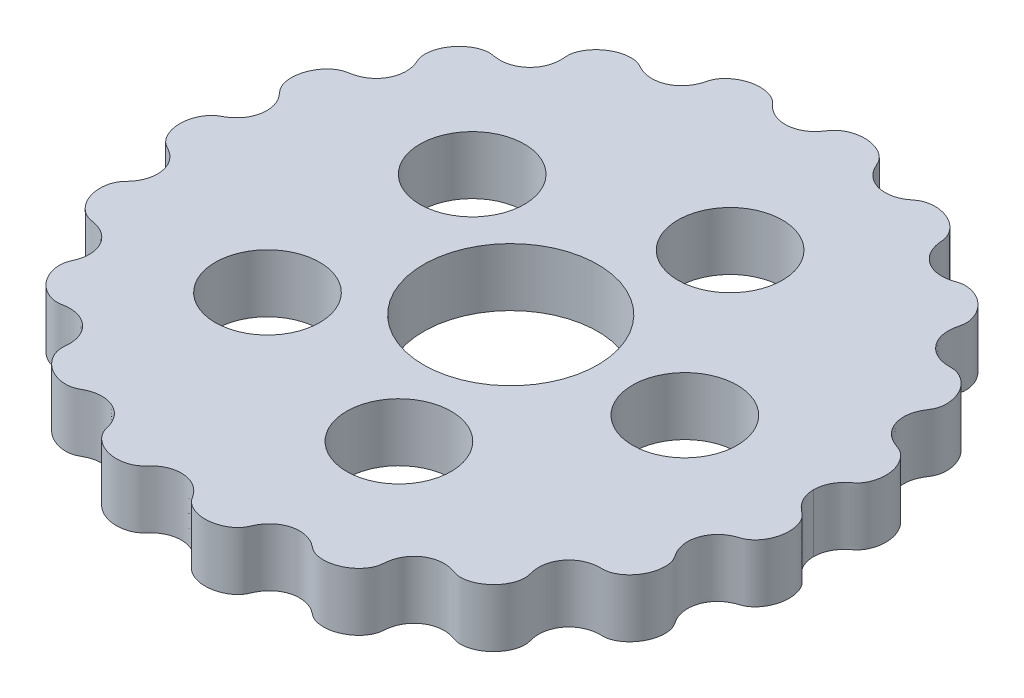
from build123d import *

# Parameters (mm, degrees)
BOSS_EXTRUDE1_START = 0.5
SKETCH1_R           = 7.5
SKETCH1_R_2         = 4.5
BOSS_EXTRUDE1_DEPTH = 5


with BuildPart() as part:
    # Sketch1 → Boss-Extrude1 (new body)
    with BuildSketch(Plane(origin=(0, 0, 0), x_dir=(1, 0, 0), z_dir=(0, 1, 0)).offset(BOSS_EXTRUDE1_START)):
        with BuildLine():
            add(Edge.make_bspline(
                [(26.100000001, 0), (26.100000001, -0.037654823), (26.101959838, -0.112657778), (26.110778914, -0.269126865), (26.134236474, -0.431457932), (26.169271903, -0.604227737), (26.215706935, -0.771665888), (26.2732951, -0.936077152), (26.341753555, -1.096140667), (26.42791585, -1.265624131), (26.534785055, -1.441856171), (26.699683699, -1.67031679), (26.901439537, -1.889875839), (27.124804262, -2.086960491), (27.362808408, -2.265185488), (27.541686596, -2.422902757), (27.696832367, -2.612532966), (27.831038284, -2.823925745), (27.942707415, -3.055157968), (28.03202713, -3.302051278), (28.113287071, -3.620150325), (28.164200717, -4.011385863), (28.158229713, -4.465911271), (28.068723695, -4.971978987), (27.92239684, -5.391891507), (27.752179239, -5.726439419), (27.579155333, -5.986088776), (27.422588117, -6.181127718), (27.208663225, -6.396612626), (26.970426875, -6.581500429), (26.704262294, -6.714420074), (26.426139512, -6.802056051), (26.208386955, -6.88526241), (25.996005014, -6.981754411), (25.792352169, -7.095680473), (25.506454674, -7.288419365), (25.166810016, -7.595932091), (24.823327667, -8.065640834), (24.573113299, -8.72284226), (24.513192387, -9.374110704), (24.595878356, -9.908866564), (24.732910005, -10.306165942), (24.863450158, -10.578322252), (24.983619743, -10.787813544), (25.118076956, -10.987994036), (25.243899655, -11.194436481), (25.335973849, -11.425133947), (25.399465389, -11.670686177), (25.434320143, -11.928228008), (25.441972483, -12.193681647), (25.418791023, -12.524941115), (25.342360013, -12.916594687), (25.191232071, -13.347764303), (24.944934542, -13.798710217), (24.636097612, -14.197365909), (24.319379047, -14.49299579), (24.014552178, -14.704170688), (23.744181638, -14.844097629), (23.521984724, -14.930759503), (23.295178334, -14.990896749), (23.066212193, -15.018050457), (22.836177534, -15.015427607), (22.60645362, -15.01876633), (22.377139997, -15.037432831), (22.149964766, -15.073477643), (21.901722716, -15.134262004), (21.63640528, -15.227464361), (21.285248205, -15.397408544), (20.867012032, -15.696199644), (20.457707614, -16.15442787), (20.167634199, -16.744097483), (20.040652676, -17.344074218), (20.044251146, -17.837567352), (20.101291606, -18.208300972), (20.178290253, -18.510160997), (20.237387066, -18.752911084), (20.254165851, -19.007094175), (20.236737197, -19.264546647), (20.175345509, -19.587685891), (20.045401482, -19.966212229), (19.825733649, -20.379092954), (19.503349148, -20.792215121), (19.125691798, -21.140607349), (18.706122195, -21.419205006), (18.312603135, -21.597813456), (17.95729147, -21.7007495), (17.659059083, -21.747208145), (17.425046357, -21.759337106), (17.196962801, -21.745982059), (16.978070969, -21.704489958), (16.767542661, -21.633081261), (16.557577445, -21.561231406), (16.343192492, -21.502693833), (16.125264663, -21.459296016), (15.796467785, -21.420434356), (15.354937396, -21.427964236), (14.788969176, -21.550301969), (14.15455542, -21.88057341), (13.666183717, -22.345893253), (13.336362649, -22.88226304), (13.173492136, -23.353715627), (13.104616128, -23.716957194), (13.076673276, -24.02279806), (13.057814189, -24.268242303), (12.998712206, -24.514111874), (12.903235056, -24.754151925), (12.744151814, -25.045309116), (12.499019902, -25.369043134), (12.155657151, -25.696338346), (11.704870213, -25.994619846), (11.211604108, -26.212225806), (10.68997676, -26.343697667), (10.221282682, -26.37756552), (9.820613034, -26.342575186), (9.498973158, -26.26665957), (9.255580912, -26.177092448), (9.029799659, -26.05655854), (8.831572762, -25.902571784), (8.58391576, -25.71111477), (8.264466121, -25.51104552), (7.810081456, -25.312340621), (7.205513819, -25.192791232), (6.550224924, -25.228730885), (5.971337018, -25.424349477), (5.536862389, -25.687803773), (5.245653307, -25.938729612), (5.055386261, -26.143844122), (4.899938262, -26.348212338), (4.774598738, -26.545523005), (4.664550041, -26.751857795), (4.569043476, -26.964881996), (4.476314366, -27.179586841), (4.353499791, -27.379281189), (4.203299856, -27.561863118), (4.032131292, -27.727950003), (3.79525899, -27.914521157), (3.482483914, -28.102825699), (3.089596665, -28.268830385), (2.604961188, -28.388334129), (2.095437226, -28.431200093), (1.573536083, -28.390048007), (1.119470453, -28.272805038), (0.751616161, -28.112409401), (0.4727867, -27.939857046), (0.273494127, -27.780889901), (0.100220004, -27.601224467), (-0.036900457, -27.400701128), (-0.167623208, -27.196704665), (-0.313051844, -27.002366981), (-0.512485215, -26.773835259), (-0.82522158, -26.489940267), (-1.286824513, -26.202366803), (-1.90652456, -26.003420899), (-2.599411552, -25.975353149), (-3.156761696, -26.100953574), (-3.565273795, -26.283242121), (-3.853430429, -26.463789354), (-4.04086224, -26.604608953), (-4.216144571, -26.760241463), (-4.380398314, -26.92724911), (-4.535647831, -27.102695562), (-4.7080389, -27.262129389), (-4.906562373, -27.395532872), (-5.122340191, -27.506639083), (-5.353111081, -27.594765526), (-5.595122061, -27.660809079), (-5.904112164, -27.714960075), (-6.280362612, -27.736643211), (-6.724192807, -27.701413515), (-7.222479813, -27.579956195), (-7.639241178, -27.403463388), (-7.974539318, -27.20159547), (-8.231562235, -27.001455404), (-8.420763278, -26.822438839), (-8.588375146, -26.628010192), (-8.72995142, -26.419225267), (-8.843841455, -26.197883212), (-8.918149441, -25.965106023), (-8.973095057, -25.727696563), (-9.043925472, -25.494305036), (-9.153099617, -25.209622768), (-9.306801805, -24.915867582), (-9.513499075, -24.623747571), (-9.839816184, -24.284860522), (-10.264400598, -23.977825959), (-10.829665694, -23.73805203), (-11.410498796, -23.660908882), (-11.87629172, -23.69638221), (-12.218754959, -23.773476834), (-12.444677349, -23.84513133), (-12.663781479, -23.935334112), (-12.876076728, -24.040286172), (-13.082031425, -24.157155246), (-13.298581127, -24.254322867), (-13.533913594, -24.317810826), (-13.780466914, -24.35378875), (-14.035834907, -24.361637388), (-14.296405869, -24.343065665), (-14.618522572, -24.288656576), (-14.994949775, -24.177456101), (-15.408578969, -23.98833338), (-15.837205257, -23.700628449), (-16.16490731, -23.393911292), (-16.404344734, -23.097848292), (-16.573318675, -22.829755719), (-16.687662049, -22.603571121), (-16.776686852, -22.372337621), (-16.837746076, -22.138542446), (-16.870186158, -21.9045043), (-16.866368415, -21.674536104), (-16.843233105, -21.446228653), (-16.832615307, -21.216921003), (-16.837266827, -20.987328792), (-16.860312682, -20.758768834), (-16.923293403, -20.419212422), (-17.071833991, -19.980587652), (-17.369040523, -19.477210915), (-17.874882375, -18.988476541), (-18.447970132, -18.67719025), (-19.027548133, -18.525710765), (-19.510111736, -18.503831617), (-19.876648139, -18.538267665), (-20.177623885, -18.593432706), (-20.42137194, -18.622411671), (-20.671244853, -18.609095567), (-20.920859774, -18.564988583), (-21.167935078, -18.490627654), (-21.4095885, -18.389962143), (-21.698210118, -18.235368531), (-22.02014446, -18.009296139), (-22.350982926, -17.698329853), (-22.663749807, -17.29065213), (-22.904833826, -16.843369276), (-23.047778376, -16.427343965), (-23.116267898, -16.057121475), (-23.132041389, -15.75076918), (-23.118687313, -15.513701439), (-23.079662445, -15.285779121), (-23.010740762, -15.071995011), (-22.917965638, -14.867945737), (-22.83178351, -14.661241535), (-22.759010837, -14.449176582), (-22.702274861, -14.232285466), (-22.657962991, -13.982307736), (-22.635886804, -13.699380389), (-22.650675117, -13.300053937), (-22.761871082, -12.783822482), (-23.029318636, -12.21492364), (-23.467562019, -11.712001704), (-23.923403017, -11.398122255), (-24.315464063, -11.222988994), (-24.609412241, -11.131419108), (-24.849484664, -11.076013531), (-25.092573068, -11.038656205), (-25.334505587, -10.990769991), (-25.569274268, -10.900544213), (-25.793687583, -10.779741828), (-26.00595477, -10.630692764), (-26.204437625, -10.457777096), (-26.430332209, -10.218351564), (-26.664824108, -9.899800806), (-26.878975385, -9.499593675), (-27.044436205, -9.01574461), (-27.129961923, -8.520121003), (-27.134474174, -8.0871314), (-27.084857153, -7.719810764), (-27.006013082, -7.425910719), (-26.920443462, -7.203342298), (-26.812236106, -6.99521479), (-26.678616217, -6.807274427), (-26.521312284, -6.639361313), (-26.367637465, -6.468593342), (-26.225484225, -6.287683037), (-26.097389186, -6.096643611), (-25.974680444, -5.876177314), (-25.864713462, -5.624531597), (-25.752433681, -5.264729725), (-25.681810261, -4.762581394), (-25.730997419, -4.146949182), (-25.961949285, -3.524047609), (-26.321265324, -3.010597952), (-26.690239717, -2.672986455), (-27.000992367, -2.462677557), (-27.274877294, -2.314024503), (-27.494163359, -2.194208061), (-27.693761752, -2.035785351), (-27.87238426, -1.849426066), (-28.029881681, -1.639477669), (-28.165833208, -1.41056993), (-28.278417605, -1.169112764), (-28.356850628, -0.949924532), (-28.409926509, -0.757383066), (-28.444786226, -0.594531067), (-28.467072671, -0.464613598), (-28.483773851, -0.334062838), (-28.494901548, -0.194206271), (-28.499073007, -0.086237954), (-28.499999999, -0.028769446), (-28.499999999, 0)],
                knots=[0.065357727, 0.065357727, 0.065357727, 0.065357727, 0.065357727, 0.066838802, 0.068319877, 0.069800952, 0.071282027, 0.072763102, 0.074244177, 0.075725252, 0.077206327, 0.079230954, 0.081255581, 0.085304836, 0.087329463, 0.08935409, 0.091378717, 0.093403344, 0.095635344, 0.097867345, 0.100099346, 0.102331347, 0.106795348, 0.11125935, 0.115505731, 0.119752112, 0.121875303, 0.123998494, 0.126121685, 0.128244875, 0.132212277, 0.134195978, 0.136179679, 0.13816338, 0.140147081, 0.142130782, 0.144114483, 0.149889299, 0.155664115, 0.161716618, 0.167769121, 0.171875721, 0.17392902, 0.17598232, 0.17803562, 0.18008892, 0.182142219, 0.184195519, 0.186452911, 0.188710303, 0.190967695, 0.193225087, 0.197739871, 0.202254655, 0.206449673, 0.210644692, 0.21483971, 0.216937219, 0.219034728, 0.220990732, 0.222946736, 0.22490274, 0.226858744, 0.228814748, 0.230770752, 0.232726756, 0.23468276, 0.237505487, 0.240328214, 0.245973668, 0.25207373, 0.258173791, 0.262418319, 0.266662848, 0.268785112, 0.270907376, 0.27302964, 0.275151904, 0.277414155, 0.279676405, 0.284200907, 0.288725408, 0.29324991, 0.297434601, 0.301619291, 0.305803982, 0.307896327, 0.309988673, 0.311878349, 0.313768025, 0.315657701, 0.317547377, 0.319437053, 0.32132673, 0.323216406, 0.325106082, 0.330697764, 0.336289446, 0.3427217, 0.349153953, 0.353337838, 0.357521724, 0.359613666, 0.361705609, 0.363797552, 0.365889495, 0.368183967, 0.37047844, 0.375067386, 0.379656332, 0.384245278, 0.388791482, 0.393337686, 0.39788389, 0.400156991, 0.402430093, 0.404562559, 0.406695025, 0.408827491, 0.410959957, 0.415224889, 0.419489821, 0.425619329, 0.431748836, 0.43728204, 0.440048642, 0.442815244, 0.444803142, 0.446791041, 0.44877894, 0.450766838, 0.452754737, 0.454742636, 0.456730534, 0.458718433, 0.460783687, 0.462848941, 0.466979449, 0.471109956, 0.475240464, 0.479777245, 0.484314026, 0.488850807, 0.491119197, 0.493387587, 0.495450918, 0.497514249, 0.499577579, 0.50164091, 0.503704241, 0.505767572, 0.509894233, 0.515977148, 0.522060063, 0.527644163, 0.533228263, 0.535221378, 0.537214493, 0.539207608, 0.541200724, 0.543193839, 0.545186954, 0.54718007, 0.549173185, 0.551305995, 0.553438805, 0.555571614, 0.557704424, 0.561970044, 0.566235664, 0.570664673, 0.575093682, 0.577308187, 0.579522691, 0.581737196, 0.583951701, 0.586025843, 0.588099985, 0.590174127, 0.592248269, 0.594322411, 0.596396553, 0.600544837, 0.603500405, 0.606455973, 0.612367108, 0.61826056, 0.624154012, 0.626168793, 0.628183573, 0.630198354, 0.632213134, 0.634227915, 0.636242695, 0.638257476, 0.640272256, 0.642493095, 0.644713933, 0.646934771, 0.64915561, 0.653597287, 0.658038963, 0.662348161, 0.666657359, 0.668811958, 0.670966557, 0.673121156, 0.675275756, 0.677228627, 0.679181499, 0.681134371, 0.683087243, 0.685040114, 0.686992986, 0.688945858, 0.69089873, 0.696785964, 0.702673198, 0.708614477, 0.714555757, 0.718723943, 0.722892129, 0.724976222, 0.727060315, 0.729144408, 0.7312285, 0.733454223, 0.735679945, 0.737905667, 0.740131389, 0.744582833, 0.749034278, 0.753292913, 0.757551548, 0.761810184, 0.763939501, 0.766068819, 0.767975191, 0.769881564, 0.771787936, 0.773694308, 0.77560068, 0.777507052, 0.779413425, 0.781319797, 0.784235185, 0.787150573, 0.792981348, 0.799176944, 0.80537254, 0.809561259, 0.811655619, 0.813749979, 0.815844338, 0.817938698, 0.820033058, 0.822127418, 0.82436519, 0.826602962, 0.828840734, 0.831078507, 0.835554051, 0.840029596, 0.844222519, 0.848415442, 0.852608365, 0.854704826, 0.856801288, 0.858757317, 0.860713346, 0.862669375, 0.864625404, 0.866581433, 0.868537462, 0.870493491, 0.872449521, 0.875160805, 0.87787209, 0.883294658, 0.889615361, 0.895936064, 0.900181909, 0.904427753, 0.906550675, 0.908673598, 0.91079652, 0.912919442, 0.915182616, 0.91744579, 0.919708964, 0.921972138, 0.924235312, 0.925366899, 0.926498486, 0.927630073, 0.92876166, 0.929893247, 0.931024834, 0.931024834, 0.931024834, 0.931024834, 0.931024834], degree=4))
            add(Edge.make_bspline(
                [(26.100000001, 0), (26.100000001, 0.037557606), (26.101960172, 0.11236891), (26.110780761, 0.268515149), (26.13424132, 0.430312775), (26.169279567, 0.602699325), (26.215712536, 0.769655849), (26.273296838, 0.933610033), (26.34172375, 1.093214643), (26.427887255, 1.262171065), (26.534631095, 1.43795663), (26.66472128, 1.617457312), (26.820221458, 1.797178198), (26.990110155, 1.963295025), (27.170908295, 2.117246114), (27.359583137, 2.261393395), (27.534725755, 2.42249524), (27.68734562, 2.613319468), (27.819402466, 2.825437943), (27.929409737, 3.056775069), (28.017350198, 3.303529964), (28.097313972, 3.62117335), (28.147180391, 4.011594981), (28.14070842, 4.466301535), (28.050717292, 4.97349364), (27.882896183, 5.454979193), (27.671504475, 5.84304381), (27.443574661, 6.144857491), (27.22674656, 6.364817609), (27.040892978, 6.516562131), (26.843642224, 6.643249286), (26.635913668, 6.738215402), (26.419935905, 6.811078154), (26.206939903, 6.891943154), (25.999467089, 6.986584145), (25.799911288, 7.096971584), (25.514583785, 7.286926669), (25.171992169, 7.593045833), (24.825107804, 8.063163706), (24.5729884, 8.722990297), (24.513513946, 9.375105339), (24.596667178, 9.908457378), (24.733854448, 10.304635684), (24.864153794, 10.57617699), (24.983841337, 10.78526845), (25.116626146, 10.985976922), (25.23781854, 11.194548661), (25.326672131, 11.425792092), (25.387836907, 11.671325816), (25.420923383, 11.928463132), (25.427271397, 12.193315352), (25.402925967, 12.523691905), (25.325735566, 12.914209418), (25.174039331, 13.345327688), (24.926907332, 13.79725834), (24.616364755, 14.197845719), (24.29698117, 14.495520079), (23.989587623, 14.708050702), (23.718534776, 14.847912779), (23.497907731, 14.934027896), (23.274665325, 14.993741496), (23.051299597, 15.022739648), (22.826527034, 15.023767999), (22.602061074, 15.027768327), (22.378022274, 15.045955423), (22.15589886, 15.080417824), (21.828556405, 15.158511555), (21.409282012, 15.322259795), (20.924725716, 15.635210396), (20.456823885, 16.157829591), (20.166872697, 16.748469446), (20.041025765, 17.347126751), (20.045267093, 17.839438354), (20.102257892, 18.209228312), (20.177807446, 18.510727554), (20.231772918, 18.754068222), (20.244874723, 19.007789076), (20.225231154, 19.26440437), (20.174580684, 19.52116384), (20.09617018, 19.774796718), (19.967529458, 20.0808296), (19.769244222, 20.426950741), (19.488368581, 20.785956985), (19.112265891, 21.132969663), (18.695113942, 21.411025317), (18.304377275, 21.589914677), (17.951596369, 21.694385138), (17.597097582, 21.752232252), (17.30274789, 21.761285903), (17.01353957, 21.72416988), (16.741890872, 21.635235734), (16.525460698, 21.563366751), (16.30449365, 21.505143996), (16.079996624, 21.463086124), (15.830837481, 21.437177305), (15.558265867, 21.434810853), (15.186128323, 21.472203392), (14.696111953, 21.603682941), (14.145806733, 21.892344423), (13.663352315, 22.3528318), (13.335089923, 22.888301692), (13.173326778, 23.358816985), (13.10466991, 23.721205101), (13.075926055, 24.026250081), (13.052488399, 24.270732841), (12.989529913, 24.514981911), (12.892121578, 24.75348234), (12.73129963, 25.042745906), (12.48537644, 25.364486059), (12.14194144, 25.6899342), (11.690895191, 25.987555412), (11.196405878, 26.205372018), (10.672319964, 26.337289188), (10.200295403, 26.371119582), (9.79682711, 26.335572462), (9.474750205, 26.259329406), (9.232977676, 26.170565191), (9.009974637, 26.052913706), (8.813709595, 25.905471503), (8.570429252, 25.719531022), (8.258164128, 25.523707411), (7.809364316, 25.324975745), (7.207254198, 25.202018598), (6.546067121, 25.235297975), (5.877241903, 25.46217649), (5.398588959, 25.786008977), (5.084963573, 26.105496235), (4.885275351, 26.374184304), (4.766566725, 26.56369587), (4.661655149, 26.761176326), (4.569316509, 26.964531297), (4.477345935, 27.168404949), (4.359380537, 27.358962353), (4.214368301, 27.53730225), (4.04657292, 27.702735184), (3.809779019, 27.892470211), (3.492450279, 28.086181237), (3.093047806, 28.256870657), (2.602432058, 28.378851651), (2.089146834, 28.422578188), (1.565967934, 28.381961626), (1.112700174, 28.266239985), (0.745063975, 28.107841233), (0.465765003, 27.937570102), (0.265546245, 27.780769343), (0.090316159, 27.603947454), (-0.050614273, 27.406772328), (-0.182236215, 27.203960446), (-0.32748241, 27.01023592), (-0.526391485, 26.782147944), (-0.838010778, 26.498557331), (-1.298111394, 26.211094086), (-1.918402994, 26.011412018), (-2.614461149, 25.984022917), (-3.173523862, 26.112524982), (-3.581992111, 26.29793532), (-3.867307934, 26.479069847), (-4.049922769, 26.617384469), (-4.221152863, 26.769533189), (-4.381916757, 26.932432711), (-4.535916963, 27.101844858), (-4.706349347, 27.255419887), (-4.902143243, 27.386349656), (-5.116496624, 27.496610446), (-5.347239404, 27.585081759), (-5.591110656, 27.651879702), (-5.902424379, 27.706740788), (-6.281662868, 27.728850923), (-6.729961118, 27.693395981), (-7.234342379, 27.570243689), (-7.65633568, 27.39048211), (-7.996662398, 27.184271517), (-8.256329457, 26.979520574), (-8.448308601, 26.796657483), (-8.651059963, 26.555390104), (-8.81700112, 26.293818775), (-8.913447768, 26.03917149), (-8.970105978, 25.812426923), (-9.032713325, 25.587290319), (-9.125707716, 25.309967392), (-9.315929764, 24.909990901), (-9.674728567, 24.436130369), (-10.183459835, 24.025846061), (-10.836211591, 23.747068892), (-11.420435291, 23.669904101), (-11.88504253, 23.705810937), (-12.226667293, 23.78306041), (-12.452036547, 23.854757813), (-12.670772627, 23.944623883), (-12.882685423, 24.04910601), (-13.089636758, 24.163269032), (-13.307649025, 24.25586997), (-13.543038731, 24.316628715), (-13.789378657, 24.350416644), (-14.044170323, 24.356729239), (-14.304069866, 24.336979732), (-14.625232977, 24.28158743), (-15.000545755, 24.169770966), (-15.412965417, 23.980630522), (-15.840661536, 23.693607689), (-16.214284288, 23.344751587), (-16.484954149, 22.99257982), (-16.669246889, 22.660103051), (-16.782520625, 22.371064468), (-16.845505845, 22.138296706), (-16.880496111, 21.905251416), (-16.881316199, 21.675736003), (-16.860821291, 21.447623517), (-16.850555776, 21.218839449), (-16.85536403, 20.989715924), (-16.878196474, 20.761647471), (-16.940732923, 20.422799562), (-17.08843954, 19.985128723), (-17.385800937, 19.480651111), (-17.894498222, 18.990461329), (-18.469877881, 18.681086595), (-18.990372753, 18.548665966), (-19.406487185, 18.518804424), (-19.705993797, 18.531117788), (-19.944219194, 18.557992616), (-20.18020116, 18.599236488), (-20.419074353, 18.623629915), (-20.665189551, 18.609868387), (-20.913081212, 18.565696025), (-21.160188551, 18.49160002), (-21.403579002, 18.390348128), (-21.694263355, 18.234921695), (-22.018523547, 18.007449916), (-22.351791039, 17.694414257), (-22.666813538, 17.283805033), (-22.909544257, 16.833152951), (-23.05328345, 16.413896066), (-23.121977202, 16.040814849), (-23.137486808, 15.73333485), (-23.124191467, 15.496830586), (-23.085834476, 15.270705519), (-23.019759809, 15.05927003), (-22.930938393, 14.856805801), (-22.846986576, 14.652472592), (-22.775838439, 14.443088067), (-22.720106096, 14.229079512), (-22.66116761, 13.897241051), (-22.644448196, 13.442707496), (-22.741948127, 12.865327357), (-23.045635909, 12.219196868), (-23.44242448, 11.764680971), (-23.836324638, 11.475330272), (-24.161017984, 11.30624965), (-24.388411484, 11.212728737), (-24.623075892, 11.13984931), (-24.862494236, 11.084293925), (-25.104833103, 11.045464818), (-25.345143534, 10.99258107), (-25.578096715, 10.899626693), (-25.800907748, 10.777130542), (-26.011679105, 10.627076499), (-26.208845564, 10.453618678), (-26.433311014, 10.213944036), (-26.666458308, 9.895605218), (-26.879612895, 9.496087062), (-27.044681042, 9.013360245), (-27.130595173, 8.518940818), (-27.136149799, 8.086925061), (-27.088099036, 7.720199825), (-27.011063531, 7.426513435), (-26.927412142, 7.203721197), (-26.82146914, 6.995052925), (-26.691353099, 6.805240004), (-26.537235643, 6.635002809), (-26.384390326, 6.464109968), (-26.24276044, 6.283380129), (-26.114855808, 6.092759784), (-25.992262138, 5.872830791), (-25.882318571, 5.621822441), (-25.770018773, 5.262920474), (-25.698994495, 4.759665907), (-25.749262159, 4.140759284), (-25.98337725, 3.517989478), (-26.344967849, 3.008162522), (-26.711826659, 2.675630855), (-27.015956615, 2.470138443), (-27.283130804, 2.323166563), (-27.49569715, 2.20242773), (-27.691533018, 2.045315012), (-27.868698672, 1.860041494), (-28.026242229, 1.650179775), (-28.163215015, 1.419802986), (-28.2766584, 1.176817038), (-28.355709733, 0.956173448), (-28.409204863, 0.762425721), (-28.444342964, 0.598457074), (-28.466807893, 0.467595465), (-28.4836432, 0.336334559), (-28.494860457, 0.1958312), (-28.499065536, 0.086806089), (-28.499999999, 0.028958742), (-28.499999999, 0)],
                knots=[0.065428509, 0.065428509, 0.065428509, 0.065428509, 0.065428509, 0.066909165, 0.06838982, 0.069870476, 0.071351132, 0.072831787, 0.074312443, 0.075793099, 0.077273754, 0.079298617, 0.08132348, 0.083348342, 0.085373205, 0.087398068, 0.089422931, 0.091447793, 0.093472656, 0.095704556, 0.097936456, 0.100168356, 0.102400256, 0.106864056, 0.111327856, 0.11561548, 0.119903104, 0.124190727, 0.126334539, 0.128478351, 0.130421745, 0.13236514, 0.134308534, 0.136251928, 0.138195322, 0.140138717, 0.142082111, 0.144025505, 0.149879071, 0.155732636, 0.161783086, 0.167833536, 0.171940286, 0.17399366, 0.176047035, 0.17810041, 0.180153784, 0.182207159, 0.184260534, 0.186517645, 0.188774756, 0.191031868, 0.193288979, 0.197803202, 0.202317424, 0.206554339, 0.210791254, 0.215028169, 0.217146627, 0.219265085, 0.22118072, 0.223096355, 0.22501199, 0.226927625, 0.22884326, 0.230758895, 0.23267453, 0.234590165, 0.240315033, 0.246039902, 0.252137777, 0.258235653, 0.262479911, 0.266724169, 0.268846298, 0.270968427, 0.273090556, 0.275212686, 0.277474466, 0.279736246, 0.281998027, 0.284259807, 0.288783368, 0.293306929, 0.297478465, 0.30165, 0.305821535, 0.307907303, 0.309993071, 0.313886946, 0.315833883, 0.31778082, 0.319727758, 0.321674695, 0.323621633, 0.32556857, 0.328264738, 0.330960906, 0.336353242, 0.34278217, 0.349211099, 0.353394823, 0.357578547, 0.359670409, 0.361762271, 0.363854133, 0.365945995, 0.3682398, 0.370533604, 0.375121214, 0.379708823, 0.384296433, 0.388884931, 0.393473428, 0.398061926, 0.400356175, 0.402650424, 0.404740985, 0.406831546, 0.408922108, 0.411012669, 0.415193791, 0.419374914, 0.425582296, 0.431789679, 0.437483986, 0.443178293, 0.445084123, 0.446989952, 0.448895782, 0.450801611, 0.452707441, 0.45461327, 0.4565191, 0.458424929, 0.460532562, 0.462640195, 0.46685546, 0.471070725, 0.47528599, 0.479822206, 0.484358421, 0.488894637, 0.491162745, 0.493430852, 0.495494138, 0.497557424, 0.49962071, 0.501683995, 0.503747281, 0.505810567, 0.509937139, 0.516017911, 0.522098683, 0.52776142, 0.533424156, 0.535376276, 0.537328396, 0.539280516, 0.541232636, 0.543184755, 0.545136875, 0.547088995, 0.549041115, 0.551195406, 0.553349697, 0.555503988, 0.557658279, 0.561966861, 0.566275442, 0.57078566, 0.575295877, 0.577550985, 0.579806094, 0.582061202, 0.584316311, 0.588303705, 0.590297402, 0.591294251, 0.592291099, 0.596278494, 0.600265888, 0.606334723, 0.612403558, 0.6182954, 0.624187243, 0.626202375, 0.628217508, 0.63023264, 0.632247772, 0.634262905, 0.636278037, 0.638293169, 0.640308302, 0.642529051, 0.6447498, 0.64697055, 0.649191299, 0.653632797, 0.658074296, 0.66238357, 0.666692845, 0.67100212, 0.673156757, 0.675311394, 0.677264526, 0.679217658, 0.68117079, 0.683123922, 0.685077055, 0.687030187, 0.688983319, 0.690936451, 0.69682189, 0.702707329, 0.708727249, 0.714747169, 0.718834421, 0.720878047, 0.722921673, 0.724965299, 0.727008925, 0.729052551, 0.731096177, 0.733342138, 0.735588098, 0.737834058, 0.740080019, 0.744571939, 0.74906386, 0.753364202, 0.757664545, 0.761964887, 0.764115058, 0.766265229, 0.768149956, 0.770034683, 0.771919409, 0.773804136, 0.775688862, 0.777573589, 0.779458316, 0.781343042, 0.787178143, 0.793013244, 0.799206318, 0.805399393, 0.807493698, 0.809588002, 0.811682307, 0.813776612, 0.815870916, 0.817965221, 0.820059526, 0.82215383, 0.82439128, 0.826628731, 0.828866181, 0.831103631, 0.835578532, 0.840053432, 0.844246889, 0.848440346, 0.852633803, 0.854730531, 0.856827259, 0.858783839, 0.860740418, 0.862696998, 0.864653577, 0.866610157, 0.868566736, 0.870523316, 0.872479895, 0.875190971, 0.877902047, 0.883324198, 0.88972267, 0.896121142, 0.90028496, 0.904448778, 0.906530687, 0.908612596, 0.910694505, 0.912776414, 0.915059729, 0.917343045, 0.91962636, 0.921909675, 0.924192991, 0.925334648, 0.926476306, 0.927617964, 0.928759621, 0.929901279, 0.931042936, 0.931042936, 0.931042936, 0.931042936, 0.931042936], degree=4))
        make_face()
        Circle(SKETCH1_R, mode=Mode.SUBTRACT)
        with Locations((15, 0)):
            Circle(SKETCH1_R_2, mode=Mode.SUBTRACT)
        with Locations((4.635254916, -14.265847744)):
            Circle(SKETCH1_R_2, mode=Mode.SUBTRACT)
        with Locations((-12.135254916, -8.816778784)):
            Circle(SKETCH1_R_2, mode=Mode.SUBTRACT)
        with Locations((-12.135254916, 8.816778784)):
            Circle(SKETCH1_R_2, mode=Mode.SUBTRACT)
        with Locations((4.635254916, 14.265847744)):
            Circle(SKETCH1_R_2, mode=Mode.SUBTRACT)
    extrude(amount=BOSS_EXTRUDE1_DEPTH)


solid = part.part
